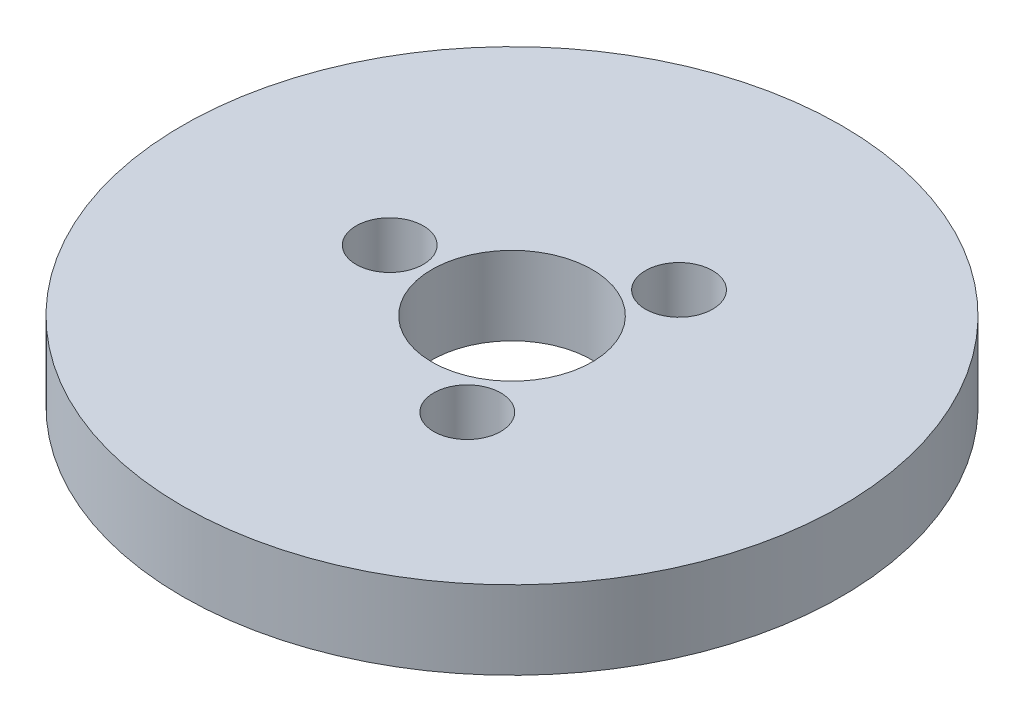
from build123d import *

# Parameters (mm, degrees)
SKETCH1_R           = 92.5
BOSS_EXTRUDE1_DEPTH = 22
SKETCH2_R           = 22.5
CUT_EXTRUDE1_DEPTH  = 133.651799837
SKETCH3_R           = 9.41448918
CUT_EXTRUDE2_DEPTH  = 18.99558503
CIRPATTERN1_COUNT   = 3


with BuildPart() as part:
    # Sketch1 → Boss-Extrude1 (new body)
    with BuildSketch(Plane(origin=(0, 0, 0), x_dir=(1, 0, 0), z_dir=(0, 1, 0))):
        Circle(SKETCH1_R)
    extrude(amount=BOSS_EXTRUDE1_DEPTH)

    # Sketch2 → Cut-Extrude1 (cut, through all)
    with BuildSketch(Plane(origin=(0, 0, 0), x_dir=(1, 0, 0), z_dir=(0, 1, 0))):
        Circle(SKETCH2_R)
    extrude(amount=CUT_EXTRUDE1_DEPTH, mode=Mode.SUBTRACT)

    # Sketch3 → Cut-Extrude2 (cut)
    with BuildSketch(Plane(origin=(0, 22, 0), x_dir=(1, 0, 0), z_dir=(0, 1, 0))):
        with Locations((-34.323711273, 0)):
            Circle(SKETCH3_R)
    cut_extrude2 = extrude(amount=-CUT_EXTRUDE2_DEPTH, mode=Mode.SUBTRACT)

    # CirPattern1: Cut-Extrude2 ×3 about axis
    cirpattern1_axis = Axis((0, 0, 0), (0, 1, 0))
    for i in range(1, CIRPATTERN1_COUNT):
        add(cut_extrude2.rotate(cirpattern1_axis, i * 360 / CIRPATTERN1_COUNT), mode=Mode.SUBTRACT)


solid = part.part
